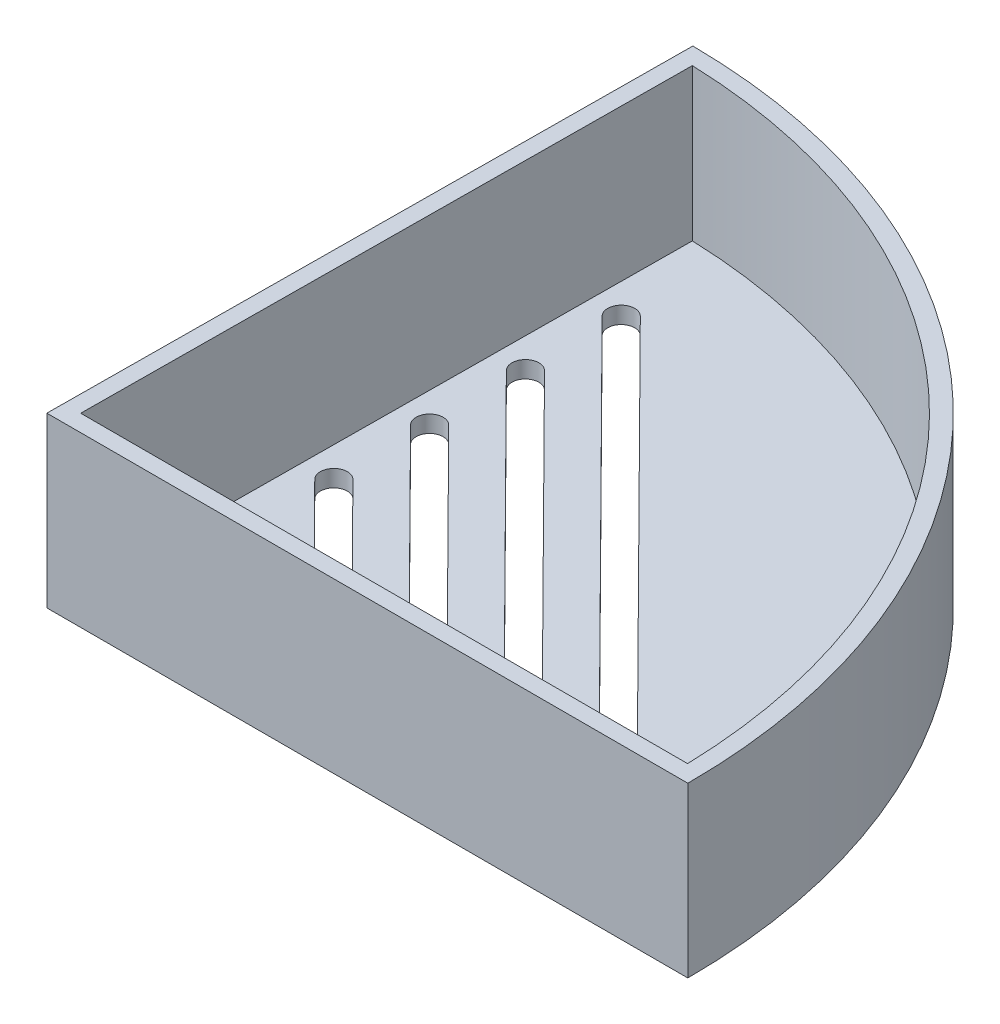
from build123d import *

# Parameters (mm, degrees)
EXTRUDE_1_DEPTH        = 50
CUT_EXTRUDE_1_DEPTH    = 45
CUT_EXTRUDE_3_DEPTH    = 274.308913017
PATTERN_LINEAR_3_DEPTH = 5


# Read off the part's stored shape, not the designer's step: 阵列(线性)3
with BuildPart() as part:
    # 草图1 → 凸台-拉伸1 (new body)
    with BuildSketch(Plane(origin=(0, 0, 0), x_dir=(1, 0, 0), z_dir=(0, 1, 0))):
        with BuildLine():
            Line((1.496016616, 189.994110262), (0, 0))
            Line((0, 0), (190, 0))
            ThreePointArc((190, 0), (134.878173099, 133.820321407), (1.496016616, 189.994110262))
        make_face()
    extrude(amount=EXTRUDE_1_DEPTH)

    # 草图2 → 切除-拉伸1 (cut)
    with BuildSketch(Plane(origin=(0, 50, 0), x_dir=(1, 0, 0), z_dir=(0, 1, 0))):
        with BuildLine():
            Line((5.039525077, 5), (184.932420089, 5))
            ThreePointArc((184.932420089, 5), (131.328747491, 130.298734001), (6.455960656, 184.887318581))
            Line((6.455960656, 184.887318581), (5.039525077, 5))
        make_face()
    extrude(amount=-CUT_EXTRUDE_1_DEPTH, mode=Mode.SUBTRACT)

    # 草图3 → 切除-拉伸3 (cut, through all)
    with BuildSketch(Plane.XZ):
        with BuildLine():
            Line((11.494321842, -39.528128563), (39.617406911, -11.182730076))
            ThreePointArc((39.617406911, -11.182730076), (45.274217322, -11.160459514), (45.296487884, -16.817269924))
            Line((45.296487884, -16.817269924), (17.173402815, -45.162668411))
            ThreePointArc((17.173402815, -45.162668411), (11.516592404, -45.184938973), (11.494321842, -39.528128563))
        make_face()
    extrude(amount=-CUT_EXTRUDE_3_DEPTH, mode=Mode.SUBTRACT)

    # 阵列(线性)3 outline → 阵列(线性)3 (cut)
    with BuildSketch(Plane(origin=(0, 0, 0), x_dir=(1, 0, 0), z_dir=(0, 1, 0))):
        with BuildLine():
            ThreePointArc((17.395235092, 73.335367655), (11.738424681, 73.357638217), (11.71615412, 67.700827806))
            Line((11.71615412, 67.700827806), (67.790979496, 11.182730076))
            ThreePointArc((67.790979496, 11.182730076), (73.447789906, 11.160459514), (73.470060469, 16.817269924))
            Line((73.470060469, 16.817269924), (17.395235092, 73.335367655))
        make_face()
        with BuildLine():
            ThreePointArc((18.060731925, 157.853465386), (12.403921514, 157.875735948), (12.381650952, 152.218925537))
            Line((12.381650952, 152.218925537), (152.311697253, 11.182730076))
            ThreePointArc((152.311697253, 11.182730076), (157.968507663, 11.160459514), (157.990778225, 16.817269924))
            Line((157.990778225, 16.817269924), (18.060731925, 157.853465386))
        make_face()
        with BuildLine():
            ThreePointArc((17.61706737, 101.508066899), (11.960256959, 101.530337461), (11.937986397, 95.87352705))
            Line((11.937986397, 95.87352705), (95.964552082, 11.182730076))
            ThreePointArc((95.964552082, 11.182730076), (101.621362492, 11.160459514), (101.643633054, 16.817269924))
            Line((101.643633054, 16.817269924), (17.61706737, 101.508066899))
        make_face()
        with BuildLine():
            ThreePointArc((17.838899648, 129.680766142), (12.182089237, 129.703036704), (12.159818675, 124.046226293))
            Line((12.159818675, 124.046226293), (124.138124667, 11.182730076))
            ThreePointArc((124.138124667, 11.182730076), (129.794935077, 11.160459514), (129.81720564, 16.817269924))
            Line((129.81720564, 16.817269924), (17.838899648, 129.680766142))
        make_face()
    extrude(amount=PATTERN_LINEAR_3_DEPTH, mode=Mode.SUBTRACT)


solid = part.part
